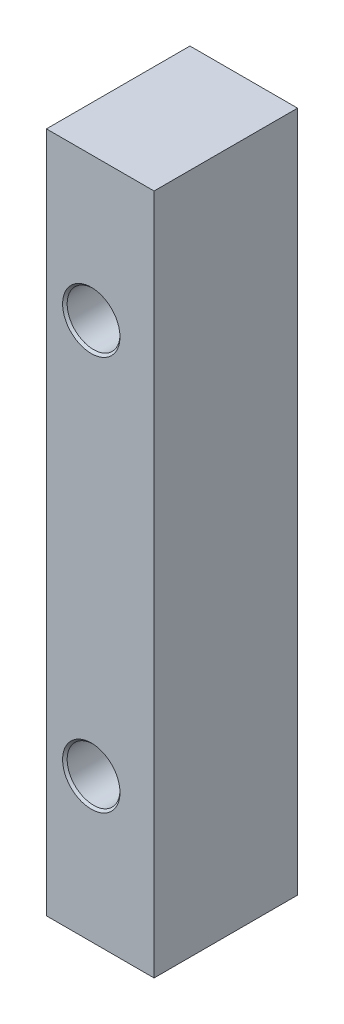
from build123d import *

# Parameters (mm, degrees)
SKETCH_1_W                = 6
SKETCH_1_H                = 38
EXTRUDE_1_DEPTH           = 8
HOLE_WIZARD_41_AT_2_COUNT = 2
HOLE_WIZARD_41_AT_2_PITCH = 22
CHAMFER_1_SIZE            = 0.449397949


with BuildPart() as part:
    # Эскиз1 → Бобышка-Вытянуть1 (new body)
    with BuildSketch(Plane.XY):
        Rectangle(SKETCH_1_W, SKETCH_1_H)
    extrude(amount=EXTRUDE_1_DEPTH)

    # Эскиз2 → Цековка для  винта с внутренним шестигранником #41 (revolve, cut)
    with BuildSketch(Plane(origin=(-0.5, 11, 0), x_dir=(0, 1, 0), z_dir=(1, 0, 0))):
        Polygon((0, 0), (0, 8), (1.6002, 8), (1.4732, 7.873), (1.4732, 2.9718), (1.6002, 2.8448), (2.77876, 2.8448), (2.77876, 0.127), (2.90576, 0), align=None)
    hole_wizard_41 = revolve(axis=Axis((-0.5, 11, -6.35), (0, 0, 1)), mode=Mode.SUBTRACT)

    # Цековка для  винта с внутренним шестигранником #41 at 2: Цековка для  винта с внутренним шестигранником #41 ×2
    with Locations(*[(0, -i * HOLE_WIZARD_41_AT_2_PITCH, 0) for i in range(1, HOLE_WIZARD_41_AT_2_COUNT)]):
        add(hole_wizard_41, mode=Mode.SUBTRACT)

    # Фаска1
    # the kernel refuses this chamfer: 0.5, 0.449397949 mm, written as the material it takes off along each edge
    with BuildSketch(Plane(origin=(-3, -9.786943061, 2.8448), x_dir=(0.5198491944846584, 0.8542580494169496, 0), z_dir=(0, 0, -1)), Plane(origin=(-3, 12.213056939, 2.8448), x_dir=(0.5198491944846584, 0.8542580494169496, 0), z_dir=(0, 0, -1))) as chamfer_1_piece_1:
        with BuildLine():
            Line((0.526718663, 0), (CHAMFER_1_SIZE * 0.854258048776, -CHAMFER_1_SIZE * 0.519849194094))
            Line((CHAMFER_1_SIZE * 0.854258048776, -CHAMFER_1_SIZE * 0.519849194094), (0, 0))
            ThreePointArc((0, 0), (0.268614935, -0.012503234), (0.526718663, 0))
        make_face()
    extrude(amount=4.061353185, mode=Mode.SUBTRACT)
    with BuildSketch(Plane(origin=(-3, -12.213056939, 2.8448), x_dir=(0.519849194484659, -0.8542580494169493, 0), z_dir=(0, 0, -1)), Plane(origin=(-3, 9.786943061, 2.8448), x_dir=(0.519849194484659, -0.8542580494169493, 0), z_dir=(0, 0, -1))) as chamfer_1_piece_2:
        with BuildLine():
            Line((0.526718663, 0), (CHAMFER_1_SIZE * 0.854258048776, CHAMFER_1_SIZE * 0.519849194094))
            Line((CHAMFER_1_SIZE * 0.854258048776, CHAMFER_1_SIZE * 0.519849194094), (0, 0))
            ThreePointArc((0, 0), (0.268614935, 0.012503234), (0.526718663, 0))
        make_face()
    extrude(amount=4.061353185, mode=Mode.SUBTRACT)


solid = part.part
